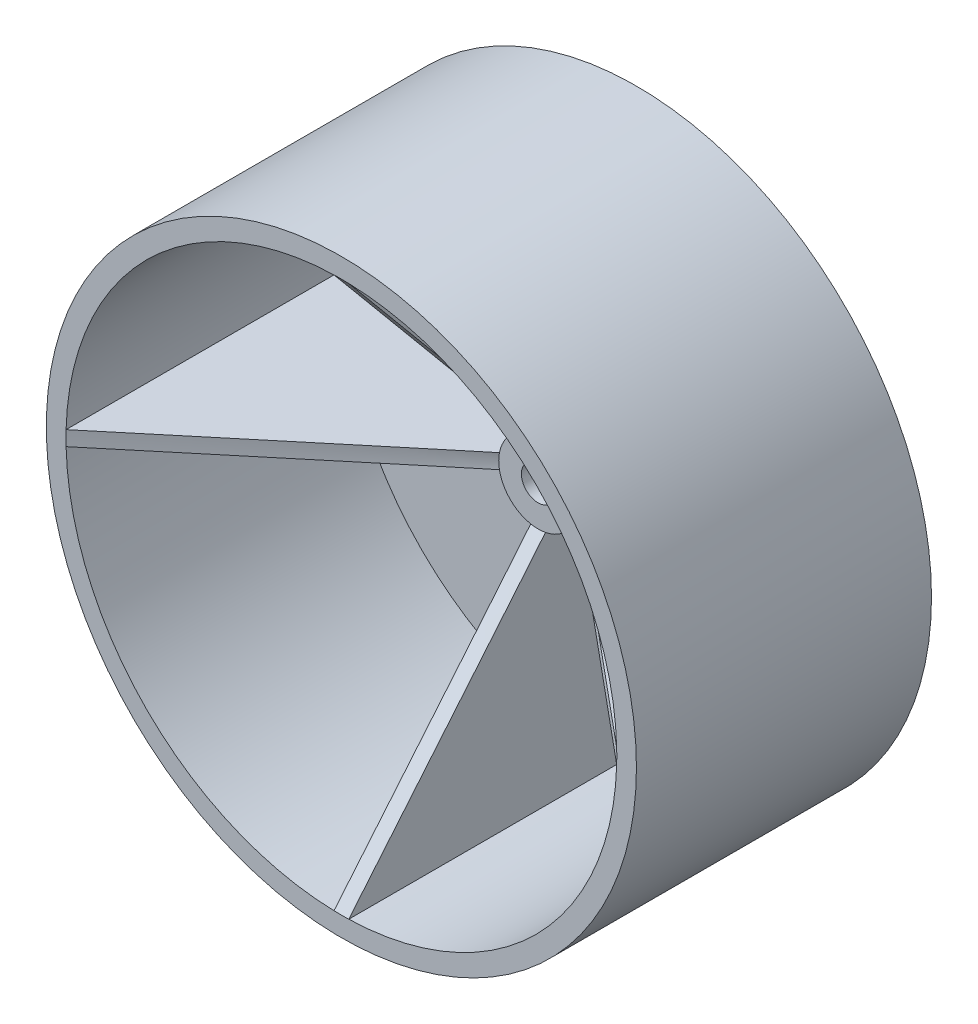
from build123d import *
from OCP.BRepFilletAPI import BRepFilletAPI_MakeChamfer

# Parameters (mm, degrees)
SKETCH1_R                      = 30
SKETCH1_R_2                    = 28
SKETCH1_R_3                    = 4
BOSS_EXTRUDE1_DEPTH            = 2
BOSS_EXTRUDE2_START            = 8
SKETCH1_3_R                    = 4
BOSS_EXTRUDE2_DEPTH            = 8
BOSS_EXTRUDE3_START            = 28
SKETCH1_4_R                    = 30
BOSS_EXTRUDE3_DEPTH            = 28
CHAMFER1_SIZE2                 = 20
CHAMFER1_SIZE                  = 24
CIRPATTERN1_COUNT              = 4
CHAMFER1_OF_CIRPATTERN1_SIZE   = 24
CHAMFER1_OF_CIRPATTERN1_SIZE_2 = 20


with BuildPart() as part:
    # Sketch1 → Boss-Extrude1 (new body)
    # profile 1 of 6: a face of its own
    with BuildSketch(Plane.XY):
        Circle(SKETCH1_R)
        Circle(SKETCH1_R_2, mode=Mode.SUBTRACT)
    # profile 2 of 6: a face of its own
    with BuildSketch(Plane.XY):
        with BuildLine():
            Line((-0.75, 27.989953555), (-0.75, 3.929058411))
            ThreePointArc((-0.75, 3.929058411), (0, 4), (0.75, 3.929058411))
            Line((0.75, 3.929058411), (0.75, 27.989953555))
            ThreePointArc((0.75, 27.989953555), (0, 28), (-0.75, 27.989953555))
        make_face()
    # profile 3 of 6: a face of its own
    with BuildSketch(Plane.XY):
        with BuildLine():
            ThreePointArc((4, 0), (-2.549509757, -3.082207001), (-0.75, 3.929058411))
            Line((-0.75, 3.929058411), (-0.75, 27.989953555))
            ThreePointArc((-0.75, 27.989953555), (-19.532024985, -20.062402648), (28, 0))
            ThreePointArc((28, 0), (20.062402648, 19.532024985), (0.75, 27.989953555))
            Line((0.75, 27.989953555), (0.75, 3.929058411))
            ThreePointArc((0.75, 3.929058411), (3.082207001, 2.549509757), (4, 0))
        make_face()
    # profile 4 of 6: a face of its own
    with BuildSketch(Plane.XY):
        with BuildLine():
            ThreePointArc((4, 0), (-2.549509757, -3.082207001), (-0.75, 3.929058411))
            Line((-0.75, 3.929058411), (-0.75, 27.989953555))
            ThreePointArc((-0.75, 27.989953555), (-19.532024985, -20.062402648), (28, 0))
            ThreePointArc((28, 0), (20.062402648, 19.532024985), (0.75, 27.989953555))
            Line((0.75, 27.989953555), (0.75, 3.929058411))
            ThreePointArc((0.75, 3.929058411), (3.082207001, 2.549509757), (4, 0))
        make_face()
    # profile 5 of 6: a face of its own
    with BuildSketch(Plane.XY):
        with BuildLine():
            Line((-0.75, 27.989953555), (-0.75, 3.929058411))
            ThreePointArc((-0.75, 3.929058411), (0, 4), (0.75, 3.929058411))
            Line((0.75, 3.929058411), (0.75, 27.989953555))
            ThreePointArc((0.75, 27.989953555), (0, 28), (-0.75, 27.989953555))
        make_face()
    # profile 6 of 6: a face of its own
    with BuildSketch(Plane.XY):
        Circle(SKETCH1_R_3)
        with BuildLine():
            ThreePointArc((-1.25, 1.152171862), (0, -1.7), (1.25, 1.152171862))
            Line((1.25, 1.152171862), (-1.25, 1.152171862))
        make_face(mode=Mode.SUBTRACT)
    extrude(amount=-BOSS_EXTRUDE1_DEPTH)

    # Sketch1<3> → Boss-Extrude2 (add)
    with BuildSketch(Plane.XY.offset(BOSS_EXTRUDE2_START)):
        Circle(SKETCH1_3_R)
        with BuildLine():
            ThreePointArc((-1.25, 1.152171862), (0, -1.7), (1.25, 1.152171862))
            Line((1.25, 1.152171862), (-1.25, 1.152171862))
        make_face(mode=Mode.SUBTRACT)
    extrude(amount=-BOSS_EXTRUDE2_DEPTH)

    # Sketch1<4> → Boss-Extrude3 (add)
    with BuildSketch(Plane.XY.offset(BOSS_EXTRUDE3_START)):
        Circle(SKETCH1_4_R)
        with BuildLine():
            Line((-0.75, 27.989953555), (-0.75, 3.929058411))
            ThreePointArc((-0.75, 3.929058411), (0, 4), (0.75, 3.929058411))
            Line((0.75, 3.929058411), (0.75, 27.989953555))
            ThreePointArc((0.75, 27.989953555), (0, -28), (-0.75, 27.989953555))
        make_face(mode=Mode.SUBTRACT)
    boss_extrude3 = extrude(amount=-BOSS_EXTRUDE3_DEPTH)

    # Chamfer1
    chamfer1_edges = [part.edges().sort_by_distance(p)[0] for p in [
        (0, 4, 28),
    ]]
    chamfer1_side = [part.faces().sort_by_distance(p)[0] for p in [
        (0, 4.4, 28),
    ]]
    chamfer(chamfer1_edges, length=CHAMFER1_SIZE - 0.0001, length2=CHAMFER1_SIZE2 - 0.0001, reference=chamfer1_side[0])  # a hair under: the kernel refuses the full size

    # CirPattern1: Boss-Extrude3 ×4 about axis
    cirpattern1_axis = Axis((0, 0, 0), (0, 0, 1))
    for i in range(1, CIRPATTERN1_COUNT):
        add(boss_extrude3.rotate(cirpattern1_axis, i * 360 / CIRPATTERN1_COUNT))

    # Chamfer1 of CirPattern1
    chamfer1_of_cirpattern1_edges_1 = [part.edges().sort_by_distance(p)[0] for p in [
        (-4, 0, 28),
    ]]
    chamfer1_of_cirpattern1_side_1 = [part.faces().sort_by_distance(p)[0] for p in [
        (-4.4, 0, 28),
    ]]
    chamfer1_of_cirpattern1_edges_2 = [part.edges().sort_by_distance(p)[0] for p in [
        (0, -4, 28),
    ]]
    chamfer1_of_cirpattern1_side_2 = [part.faces().sort_by_distance(p)[0] for p in [
        (0, -4.4, 28),
    ]]
    chamfer1_of_cirpattern1_edges_3 = [part.edges().sort_by_distance(p)[0] for p in [
        (4, 0, 28),
    ]]
    chamfer1_of_cirpattern1_side_3 = [part.faces().sort_by_distance(p)[0] for p in [
        (4.4, 0, 28),
    ]]
    chamfer1_of_cirpattern1 = BRepFilletAPI_MakeChamfer(part.part.solid().wrapped)
    for e in chamfer1_of_cirpattern1_edges_1:
        chamfer1_of_cirpattern1.Add(CHAMFER1_OF_CIRPATTERN1_SIZE - 0.0001, CHAMFER1_OF_CIRPATTERN1_SIZE_2 - 0.0001, e.wrapped, chamfer1_of_cirpattern1_side_1[0].wrapped)
    for e in chamfer1_of_cirpattern1_edges_2:
        chamfer1_of_cirpattern1.Add(CHAMFER1_OF_CIRPATTERN1_SIZE - 0.0001, CHAMFER1_OF_CIRPATTERN1_SIZE_2 - 0.0001, e.wrapped, chamfer1_of_cirpattern1_side_2[0].wrapped)
    for e in chamfer1_of_cirpattern1_edges_3:
        chamfer1_of_cirpattern1.Add(CHAMFER1_OF_CIRPATTERN1_SIZE - 0.0001, CHAMFER1_OF_CIRPATTERN1_SIZE_2 - 0.0001, e.wrapped, chamfer1_of_cirpattern1_side_3[0].wrapped)
    add(Compound.cast(chamfer1_of_cirpattern1.Shape()), mode=Mode.REPLACE)  # a hair under: the kernel refuses the full size


solid = part.part
